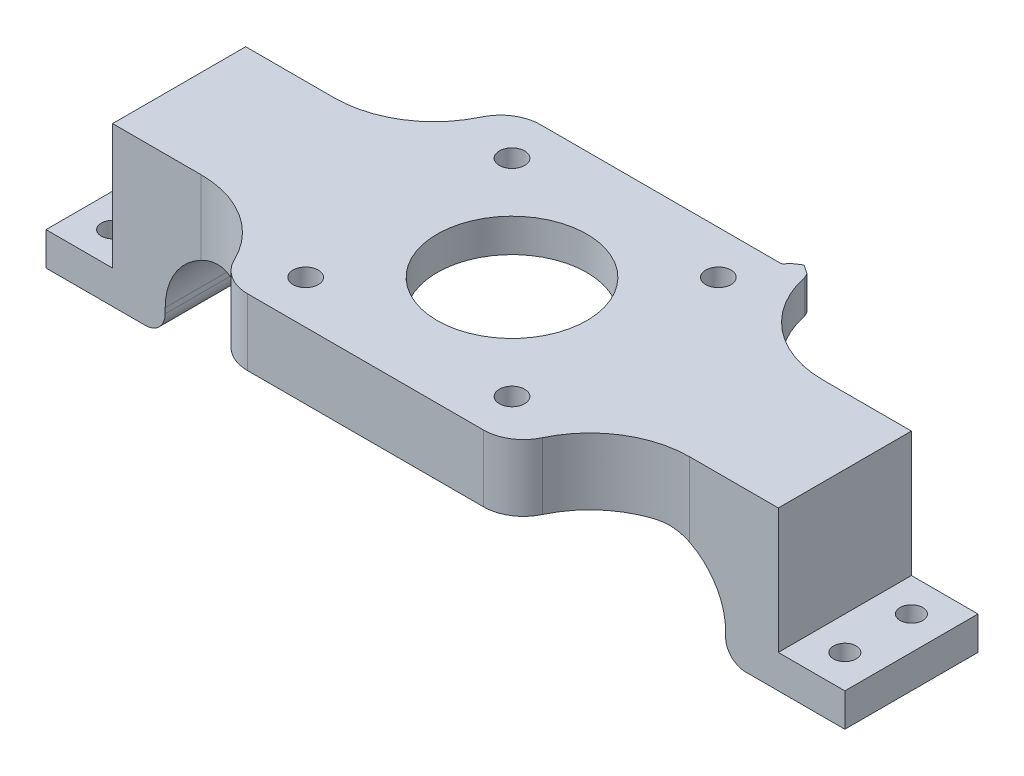
from build123d import *

# Parameters (mm, degrees)
AUFSATZ_LINEAR_AUSTRAGEN1_DEPTH      = 10
SKIZZE6_R                            = 1.9
SKIZZE6_R_2                          = 11.25
SCHNITT_LINEAR_AUSTRAGEN4_DEPTH      = 67.632124385
SKIZZE7_W                            = 20.880821379
SKIZZE7_H                            = 5
SCHNITT_LINEAR_AUSTRAGEN5_DEPTH      = 87.970339772
VERRUNDUNG3_R                        = 15
SCHNITT_LINEAR_AUSTRAGEN6_DEPTH      = 69.73136111
SCHNITT_LINEAR_AUSTRAGEN6_DEPTH_BACK = 69.73136111
SKIZZE8_W                            = 10
SKIZZE8_H                            = 10
AUFSATZ_LINEAR_AUSTRAGEN4_DEPTH      = 20
VERRUNDUNG7_R                        = 10
VERRUNDUNG8_R                        = 3
SKIZZE16_R                           = 1.7
SCHNITT_LINEAR_AUSTRAGEN8_DEPTH      = 10
AUFSATZ_LINEAR_AUSTRAGEN6_DEPTH      = 5
VERRUNDUNG9_R                        = 0.5
FASE1_START                          = -13.795598923
FASE1_DEPTH                          = 18.795598923
VERRUNDUNG10_R                       = 10
VERRUNDUNG11_R                       = 6


with BuildPart() as part:
    # Skizze1 → Aufsatz-Linear austragen1 (new body)
    with BuildSketch(Plane(origin=(0, 0, 0), x_dir=(1, 0, 0), z_dir=(0, 1, 0))):
        Polygon((-60, -4.8), (-22, -4.8), (-22, -16.8), (22, -16.8), (22, -4.8), (60, -4.8), (60, 15.2), (22, 15.2), (22, 27.2), (0, 27.2), (-22, 27.2), (-22, 15.2), (-60, 15.2), align=None)
    extrude(amount=AUFSATZ_LINEAR_AUSTRAGEN1_DEPTH)

    # Skizze6 → Schnitt-Linear austragen4 (cut, through all)
    with BuildSketch(Plane(origin=(0, 10, 0), x_dir=(1, 0, 0), z_dir=(0, 1, 0))):
        with Locations(Location((15.5, 20.7, 0), (0, 0, 270))):
            Circle(SKIZZE6_R)
        with Locations(Location((15.5, -10.3, 0), (0, 0, 270))):
            Circle(SKIZZE6_R)
        with Locations(Location((-15.5, -10.3, 0), (0, 0, 270))):
            Circle(SKIZZE6_R)
        with Locations(Location((-15.5, 20.7, 0), (0, 0, 270))):
            Circle(SKIZZE6_R)
        with Locations(Location((0, 5.2, 0), (0, 0, 270))):
            Circle(SKIZZE6_R_2)
    extrude(amount=-SCHNITT_LINEAR_AUSTRAGEN4_DEPTH, mode=Mode.SUBTRACT)

    # Skizze7 → Schnitt-Linear austragen5 (cut, through all)
    with BuildSketch(Plane.ZY.offset(22)):
        with Locations((-25.64041069, 2.5)):
            Rectangle(SKIZZE7_W, SKIZZE7_H)
    extrude(amount=-SCHNITT_LINEAR_AUSTRAGEN5_DEPTH, mode=Mode.SUBTRACT)

    # Verrundung3
    # the kernel refuses this fillet: 15 mm, written as the material it adds along each edge
    with BuildSketch(Plane(origin=(-22, 5, -15.2), x_dir=(0, 0, -1), z_dir=(0, 1, 0))) as verrundung3_piece_1:
        with BuildLine():
            CenterArc((15, 14.696938457), VERRUNDUNG3_R, 180, 78.463040967)
            Line((0, 14.696938457), (-0.3, 14.696938457))
            Line((-0.3, 14.696938457), (-0.3, 0))
            Line((-0.3, 0), (0, -0.3))
            ThreePointArc((0, -0.3), (6, -0.3), (11.94, -0.293938769))
            Line((11.94, -0.293938769), (12, 0))
        make_face()
    extrude(amount=5)
    with BuildSketch(Plane(origin=(-22, 0, 4.8), x_dir=(-1, 0, 0), z_dir=(0, 1, 0))) as verrundung3_piece_2:
        with BuildLine():
            CenterArc((14.696938457, 15), VERRUNDUNG3_R, 191.536959033, 78.463040967)
            Line((0, 12), (-0.293938769, 11.94))
            ThreePointArc((-0.293938769, 11.94), (-0.3, 6), (-0.3, 0))
            Line((-0.3, 0), (0, -0.3))
            Line((0, -0.3), (14.696938457, -0.3))
            Line((14.696938457, -0.3), (14.696938457, 0))
        make_face()
    extrude(amount=10)
    with BuildSketch(Plane(origin=(22, 0, 4.8), x_dir=(1, 0, 0), z_dir=(0, 1, 0))) as verrundung3_piece_3:
        with BuildLine():
            CenterArc((14.696938457, -15), VERRUNDUNG3_R, 90, 78.463040967)
            Line((0, -12), (-0.293938769, -11.94))
            ThreePointArc((-0.293938769, -11.94), (-0.3, -6), (-0.3, 0))
            Line((-0.3, 0), (0, 0.3))
            Line((0, 0.3), (14.696938457, 0.3))
            Line((14.696938457, 0.3), (14.696938457, 0))
        make_face()
    extrude(amount=10)
    with BuildSketch(Plane(origin=(22, 5, -15.2), x_dir=(1, 0, 0), z_dir=(0, 1, 0))) as verrundung3_piece_4:
        with BuildLine():
            CenterArc((14.696938457, 15), VERRUNDUNG3_R, 191.536959033, 78.463040967)
            Line((0, 12), (-0.293938769, 11.94))
            ThreePointArc((-0.293938769, 11.94), (-0.3, 6), (-0.3, 0))
            Line((-0.3, 0), (0, -0.3))
            Line((0, -0.3), (14.696938457, -0.3))
            Line((14.696938457, -0.3), (14.696938457, 0))
        make_face()
    extrude(amount=5)

    # Skizze8 → Schnitt-Linear austragen6 (cut, two sides: drawn at the far end of the back side and taken through both)
    with BuildSketch(Plane(origin=(0, 0, -15.2), x_dir=(-1, 0, 0), z_dir=(0, 0, -1)).offset(-SCHNITT_LINEAR_AUSTRAGEN6_DEPTH_BACK)):
        with Locations((-55, 5)):
            Rectangle(SKIZZE8_W, SKIZZE8_H)
        with Locations((55, 5)):
            Rectangle(SKIZZE8_W, SKIZZE8_H)
    extrude(amount=SCHNITT_LINEAR_AUSTRAGEN6_DEPTH + SCHNITT_LINEAR_AUSTRAGEN6_DEPTH_BACK, mode=Mode.SUBTRACT)

    # Skizze12 → Aufsatz-Linear austragen4 (add)
    with BuildSketch(Plane(origin=(0, 0, -15.2), x_dir=(-1, 0, 0), z_dir=(0, 0, -1))):
        Polygon((-50, 0), (-50, -8.795598923), (-60, -8.795598923), (-60, -13.795598923), (-42.093723734, -13.795598923), (-42.093723734, 0), align=None)
        Polygon((50, 0), (42.093723734, 0), (42.093723734, -13.795598923), (60, -13.795598923), (60, -8.795598923), (50, -8.795598923), align=None)
    extrude(amount=-AUFSATZ_LINEAR_AUSTRAGEN4_DEPTH)

    # Verrundung7
    verrundung7_edges = [part.edges().sort_by_distance(p)[0] for p in [
        (42.093723734, 0, -5.2),
        (-42.093723734, 0, -5.2),
    ]]
    fillet(verrundung7_edges, radius=VERRUNDUNG7_R)

    # Verrundung8
    verrundung8_edges = [part.edges().sort_by_distance(p)[0] for p in [
        (42.093723734, -13.795598923, -5.2),
        (-42.093723734, -13.795598923, -5.2),
    ]]
    fillet(verrundung8_edges, radius=VERRUNDUNG8_R)

    # Skizze16 → Schnitt-Linear austragen8 (cut)
    with BuildSketch(Plane.XZ.offset(13.795598923)):
        with Locations(Location((-55, -10.2, 0), (0, 0, 270))):
            Circle(SKIZZE16_R)
        with Locations(Location((-55, -0.2, 0), (0, 0, 180))):
            Circle(SKIZZE16_R)
        with Locations(Location((55, -0.2, 0), (0, 0, 270))):
            Circle(SKIZZE16_R)
        with Locations(Location((55, -10.2, 0), (0, 0, 180))):
            Circle(SKIZZE16_R)
    extrude(amount=-SCHNITT_LINEAR_AUSTRAGEN8_DEPTH, mode=Mode.SUBTRACT)

    # Skizze17 → Aufsatz-Linear austragen6 (add)
    with BuildSketch(Plane.XZ.offset(-5)):
        Polygon((22, -27.2), (20.323301152, -27.2), (20.323301152, -28.736029672), (21.681082582, -27.841522035), align=None)
        Polygon((20.323301152, -28.736029672), (20.323301152, -27.2), (18.646602303, -27.2), (18.965519721, -27.841522035), align=None)
    extrude(amount=-AUFSATZ_LINEAR_AUSTRAGEN6_DEPTH)

    # Verrundung9
    verrundung9_edges = [part.edges().sort_by_distance(p)[0] for p in [
        (22, 7.5, -27.2),
        (18.646602303, 7.5, -27.2),
        (21.681082582, 7.5, -27.841522035),
        (18.965519721, 7.5, -27.841522035),
    ]]
    fillet(verrundung9_edges, radius=VERRUNDUNG9_R)

    # Fase1: read off the stored shape, not the designer's step
    # Fase1 outline → Fase1 (cut)
    with BuildSketch(Plane(origin=(0, 0, 0), x_dir=(1, 0, 0), z_dir=(0, 1, 0)).offset(FASE1_START)):
        with BuildLine():
            Line((-5.153882032, 15.2), (-33.153882032, 15.2))
            Line((-33.153882032, 15.2), (-8.71856035, -1.90979644))
            ThreePointArc((-8.71856035, -1.90979644), (-11.013512063, 7.494570119), (-5.153882032, 15.2))
        make_face()
        with BuildLine():
            ThreePointArc((5.153882032, 15.2), (11.013512063, 7.494570119), (8.71856035, -1.90979644))
            Line((8.71856035, -1.90979644), (33.153882032, 15.2))
            Line((33.153882032, 15.2), (5.153882032, 15.2))
        make_face()
    extrude(amount=FASE1_DEPTH, mode=Mode.SUBTRACT)

    # Verrundung10
    verrundung10_edges = [part.edges().sort_by_distance(p)[0] for p in [
        (-8.71856035, 2.5, 1.90979644),
        (8.71856035, 2.5, 1.90979644),
        (-33.153882032, 2.471822211, -15.2),
        (33.153882032, 2.471822211, -15.2),
    ]]
    fillet(verrundung10_edges, radius=VERRUNDUNG10_R)

    # Verrundung11
    verrundung11_edges = [part.edges().sort_by_distance(p)[0] for p in [
        (22, 5, 16.8),
        (-22, 5, 16.8),
        (-22, 7.5, -27.2),
    ]]
    fillet(verrundung11_edges, radius=VERRUNDUNG11_R)


solid = part.part
